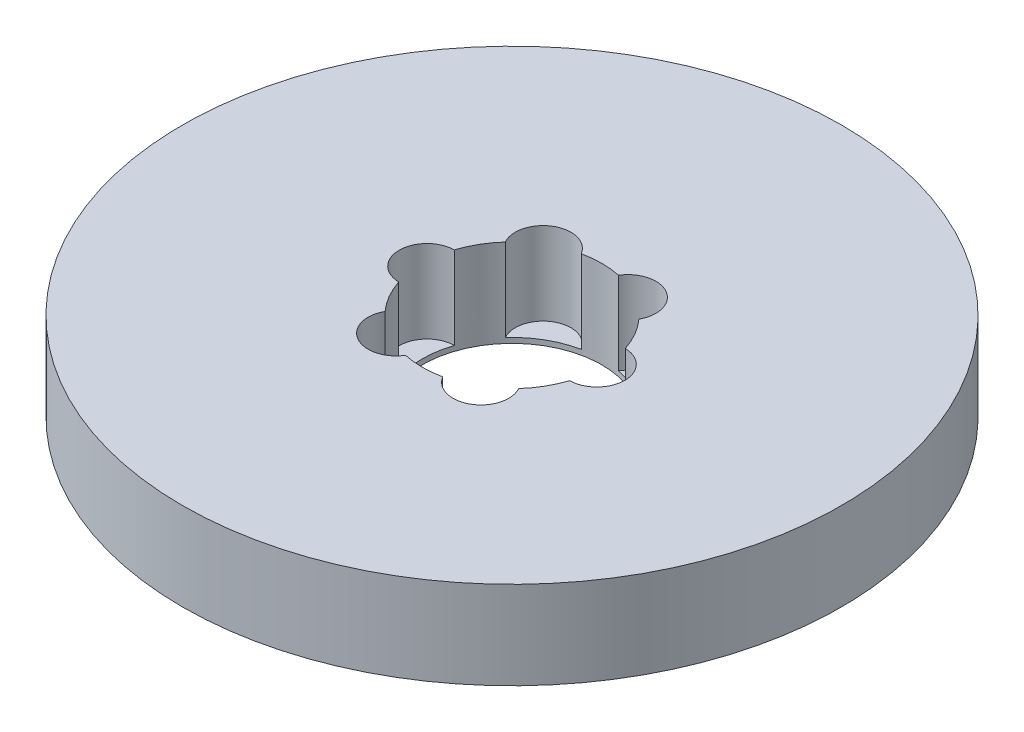
from build123d import *

# Parameters (mm, degrees)
SKETCH1_R           = 82.5
BOSS_EXTRUDE1_DEPTH = 22
SKETCH2_R           = 22.5
CUT_EXTRUDE1_DEPTH  = 119.728682297
SKETCH3_R           = 6.963583344
CUT_EXTRUDE2_DEPTH  = 20.712310447
CIRPATTERN1_COUNT   = 6


with BuildPart() as part:
    # Sketch1 → Boss-Extrude1 (new body)
    with BuildSketch(Plane(origin=(0, 0, 0), x_dir=(1, 0, 0), z_dir=(0, 1, 0))):
        Circle(SKETCH1_R)
    extrude(amount=BOSS_EXTRUDE1_DEPTH)

    # Sketch2 → Cut-Extrude1 (cut, through all)
    with BuildSketch(Plane(origin=(0, 0, 0), x_dir=(1, 0, 0), z_dir=(0, 1, 0))):
        Circle(SKETCH2_R)
    extrude(amount=CUT_EXTRUDE1_DEPTH, mode=Mode.SUBTRACT)

    # Sketch3 → Cut-Extrude2 (cut)
    with BuildSketch(Plane(origin=(0, 22, 0), x_dir=(1, 0, 0), z_dir=(0, 1, 0))):
        with Locations((-21.270476699, 0)):
            Circle(SKETCH3_R)
    cut_extrude2 = extrude(amount=-CUT_EXTRUDE2_DEPTH, mode=Mode.SUBTRACT)

    # CirPattern1: Cut-Extrude2 ×6 about axis
    cirpattern1_axis = Axis((0, 0, 0), (0, 1, 0))
    for i in range(1, CIRPATTERN1_COUNT):
        add(cut_extrude2.rotate(cirpattern1_axis, i * 360 / CIRPATTERN1_COUNT), mode=Mode.SUBTRACT)


solid = part.part
